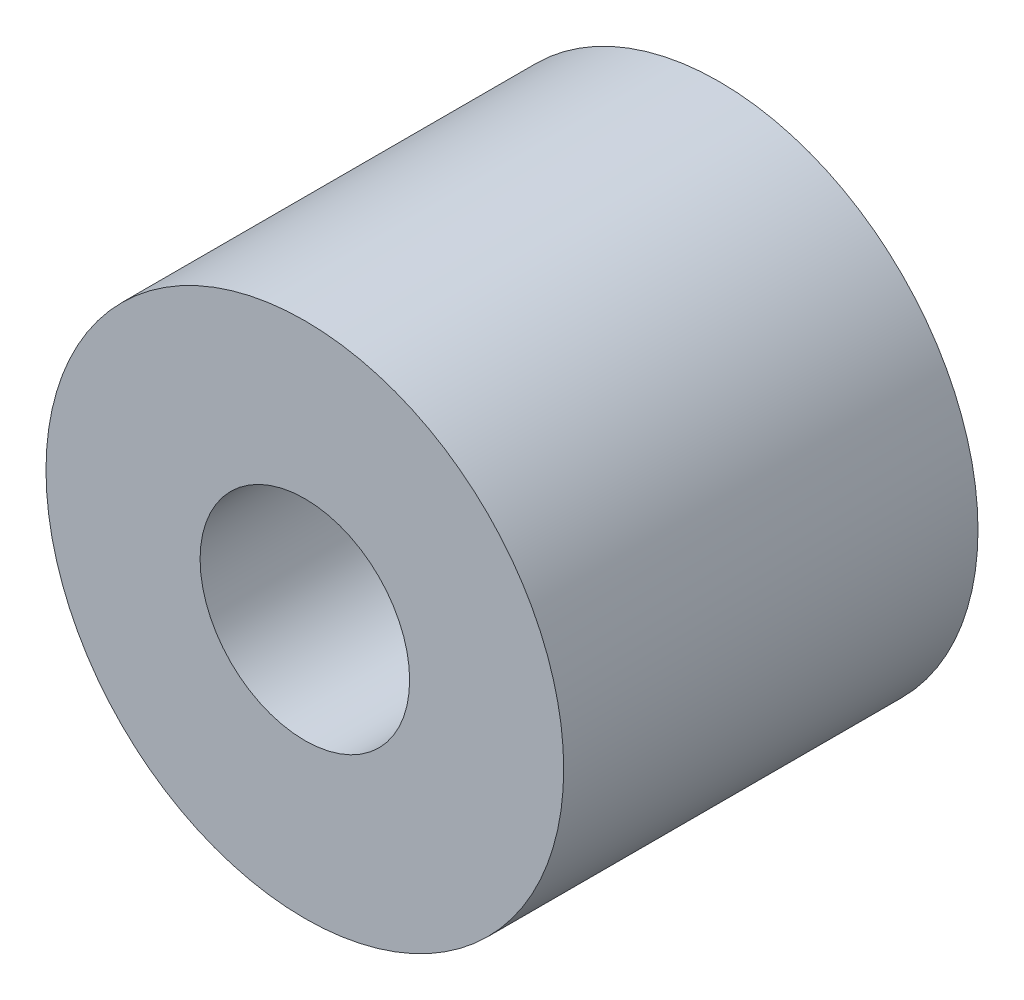
from build123d import *

# Parameters (mm, degrees)
SKETCH1_W           = 3.125
SKETCH1_H           = 3.75
SKETCH2_R           = 5.25
SKETCH2_R_2         = 2.125
BOSS_EXTRUDE1_DEPTH = 4.65242


with BuildPart() as part:
    # Sketch1 → Revolve1 (revolve)
    with BuildSketch(Plane(origin=(0, 0, 0), x_dir=(1, 0, 0), z_dir=(0, 1, 0))):
        with Locations((3.6875, -1.875)):
            Rectangle(SKETCH1_W, SKETCH1_H)
    revolve(axis=Axis((0, 0, 0), (0, 0, 1)))

    # Sketch2 → Boss-Extrude1 (add)
    with BuildSketch(Plane.XY.offset(3.75)):
        Circle(SKETCH2_R)
        Circle(SKETCH2_R_2, mode=Mode.SUBTRACT)
    extrude(amount=BOSS_EXTRUDE1_DEPTH)


solid = part.part
